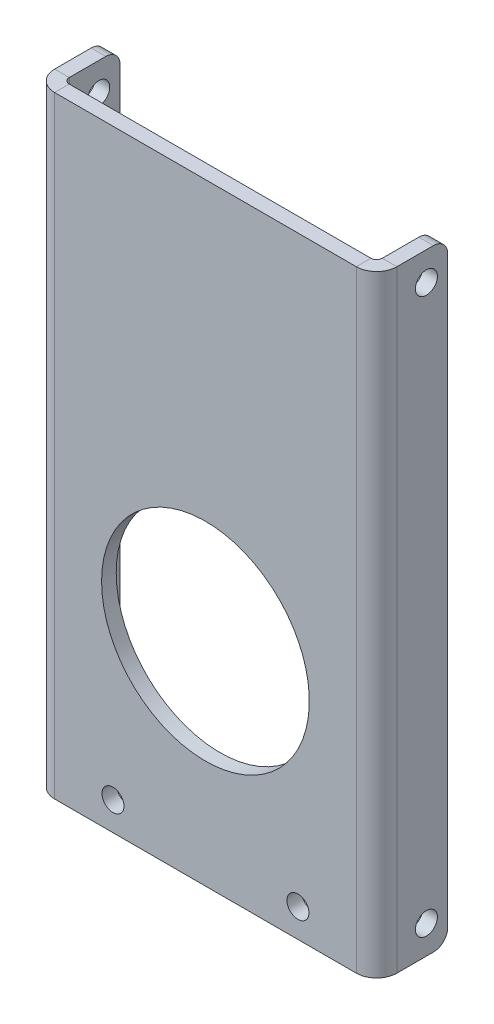
from build123d import *

# Parameters (mm, degrees)
SKETCH1_W                      = 76.3778
SKETCH1_H                      = 136.525
BASE_FLANGE1_DEPTH             = 3.2639
EDGE_FLANGE1_STRIP_W           = 15.5956
EDGE_FLANGE1_STRIP_H           = 3.2639
EDGE_FLANGE1_STRIP_CUT_DEPTH   = 136.525
EDGE_FLANGE1_STRIP_2_W         = 15.5956
EDGE_FLANGE1_STRIP_2_H         = 3.2639
EDGE_FLANGE1_STRIP_CUT_2_DEPTH = 136.525
EDGE_FLANGE1_DEPTH             = 136.525
EDGE_FLANGE1_BEND_DEPTH        = 136.525
F_10_0_1935_DIAMETER_HOLE1_D   = 4.9149
SKETCH32_R                     = 23.1775
CUT_EXTRUDE1_DEPTH             = 98.843921173
F_10_0_1935_DIAMETER_HOLE2_D   = 4.9149
FILLET1_R                      = 3.175


# Sheet-metal steps are written as plain solids
with BuildPart() as part:
    # Sketch1 → Base-Flange1 (new body)
    with BuildSketch(Plane.XY):
        with Locations((0, 20.933918)):
            Rectangle(SKETCH1_W, SKETCH1_H)
    extrude(amount=-BASE_FLANGE1_DEPTH)

    # Edge-Flange1 strip (across the edge) → Edge-Flange1 strip cut (cut)
    with BuildSketch(Plane(origin=(38.1889, 89.196418, -3.2639), x_dir=(-1, 0, 0), z_dir=(0, -1, 0))):
        with Locations((-3.2639, -1.63195)):
            Rectangle(EDGE_FLANGE1_STRIP_W, EDGE_FLANGE1_STRIP_H)
    extrude(amount=EDGE_FLANGE1_STRIP_CUT_DEPTH, mode=Mode.SUBTRACT)

    # Edge-Flange1 strip 2 (across the edge) → Edge-Flange1 strip cut 2 (cut)
    with BuildSketch(Plane(origin=(-38.1889, -47.328582, -3.2639), x_dir=(1, 0, 0), z_dir=(0, 1, 0))):
        with Locations((-3.2639, -1.63195)):
            Rectangle(EDGE_FLANGE1_STRIP_2_W, EDGE_FLANGE1_STRIP_2_H)
    extrude(amount=EDGE_FLANGE1_STRIP_CUT_2_DEPTH, mode=Mode.SUBTRACT)

    # Edge-Flange1 section (across the edge) → Edge-Flange1 (add)
    with BuildSketch(Plane(origin=(38.1889, 89.196418, -3.2639), x_dir=(-1, 0, 0), z_dir=(0, -1, 0))):
        with BuildLine():
            Line((0, 1.27), (0, 12.6111))
            Line((0, 12.6111), (3.2639, 12.6111))
            Line((3.2639, 12.6111), (3.2639, 1.27))
            ThreePointArc((3.2639, 1.27), (3.635874388, 0.371974388), (4.5339, 0))
            Line((4.5339, 0), (4.5339, -3.2639))
            ThreePointArc((4.5339, -3.2639), (1.327948565, -1.935951435), (0, 1.27))
        make_face()
    extrude(amount=EDGE_FLANGE1_DEPTH)

    # Edge-Flange1 section 2 (across the edge) → Edge-Flange1 bend (add)
    with BuildSketch(Plane(origin=(-38.1889, -47.328582, -3.2639), x_dir=(1, 0, 0), z_dir=(0, 1, 0))):
        with BuildLine():
            Line((0, 1.27), (0, 12.6111))
            Line((0, 12.6111), (3.2639, 12.6111))
            Line((3.2639, 12.6111), (3.2639, 1.27))
            ThreePointArc((3.2639, 1.27), (3.635874388, 0.371974388), (4.5339, 0))
            Line((4.5339, 0), (4.5339, -3.2639))
            ThreePointArc((4.5339, -3.2639), (1.327948565, -1.935951435), (0, 1.27))
        make_face()
    extrude(amount=EDGE_FLANGE1_BEND_DEPTH)

    # #10 (0.1935) Diameter Hole1 (through all)
    with Locations(Plane(origin=(38.1889, 0, 0), x_dir=(0, 0, -1), z_dir=(1, 0, 0))):
        with Locations((11.1125, 82.846418), (11.1125, -40.978582)):
            Hole(F_10_0_1935_DIAMETER_HOLE1_D / 2)

    # Sketch32 → Cut-Extrude1 (cut, through all)
    with BuildSketch(Plane(origin=(0, 0, -3.2639), x_dir=(-1, 0, 0), z_dir=(0, 0, -1))):
        Circle(SKETCH32_R)
    extrude(amount=-CUT_EXTRUDE1_DEPTH, mode=Mode.SUBTRACT)

    # #10 (0.1935) Diameter Hole2 (through all)
    with Locations(Plane.XY):
        with Locations((-20.6375, -40.978582), (20.6375, -40.978582)):
            Hole(F_10_0_1935_DIAMETER_HOLE2_D / 2)

    # Fillet1
    fillet1_edges = [part.edges().sort_by_distance(p)[0] for p in [
        (36.55695, 89.196418, -15.875),
        (36.55695, -47.328582, -15.875),
        (-36.55695, -47.328582, -15.875),
        (-36.55695, 89.196418, -15.875),
    ]]
    fillet(fillet1_edges, radius=FILLET1_R)


solid = part.part
